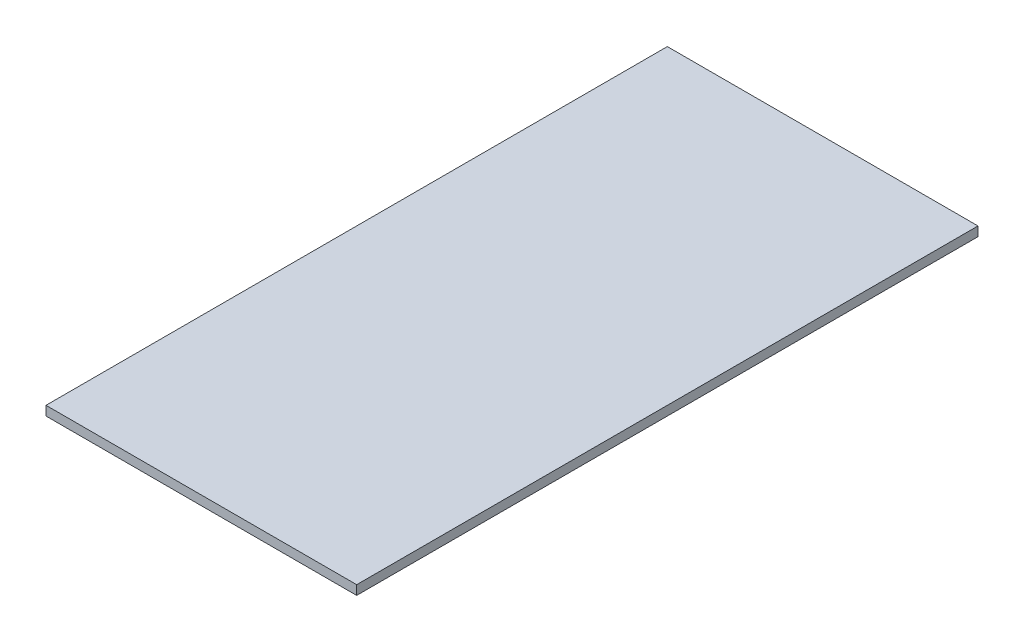
from build123d import *

# Parameters (mm, degrees)
SKETCH1_W           = 100
SKETCH1_H           = 200
BOSS_EXTRUDE1_DEPTH = 3


with BuildPart() as part:
    # Sketch1 → Boss-Extrude1 (new body)
    with BuildSketch(Plane(origin=(0, 0, 0), x_dir=(1, 0, 0), z_dir=(0, 1, 0))):
        Rectangle(SKETCH1_W, SKETCH1_H)
    extrude(amount=BOSS_EXTRUDE1_DEPTH)


solid = part.part
